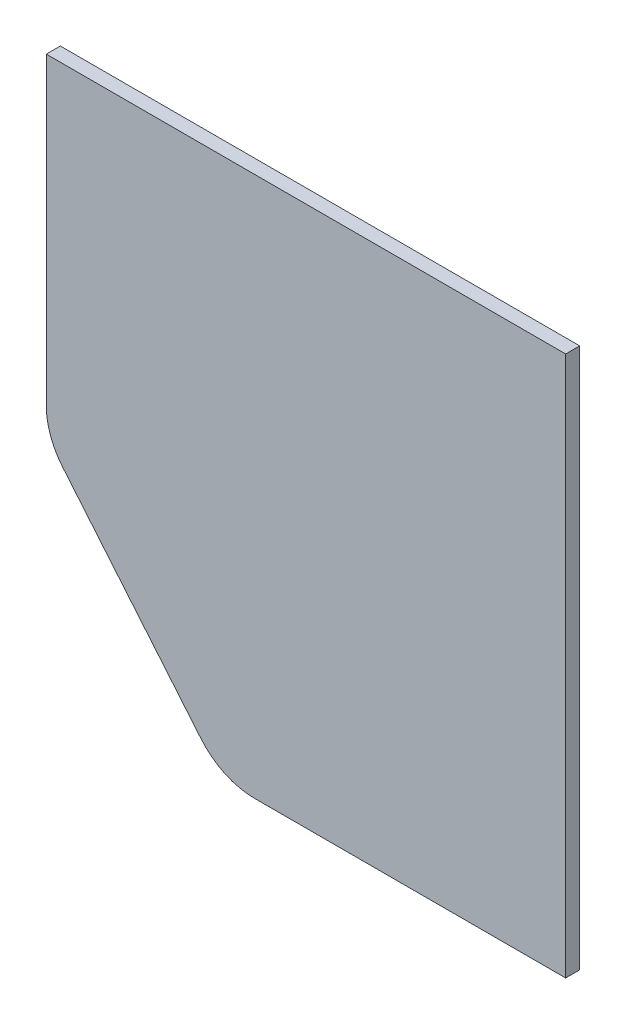
from build123d import *

# Parameters (mm, degrees)
ESBO_O1_W                  = 74
ESBO_O1_H                  = 77
RESSALTO_EXTRUS_O1_DEPTH   = 2
CORTE_EXTRUS_O1_DEPTH      = 97.782446012
CORTE_EXTRUS_O1_DEPTH_BACK = 97.782446012
FILETE1_R                  = 10
FILETE2_R                  = 10


with BuildPart() as part:
    # Esboço1 → Ressalto-extrusão1 (new body)
    with BuildSketch(Plane.XY):
        with Locations((-49.165685596, 5.526315789)):
            Rectangle(ESBO_O1_W, ESBO_O1_H)
    extrude(amount=RESSALTO_EXTRUS_O1_DEPTH)

    # Esboço2 → Corte-extrusão1 (cut, two sides: drawn at the far end of the back side and taken through both)
    with BuildSketch(Plane.XY.offset(2).offset(-CORTE_EXTRUS_O1_DEPTH_BACK)):
        Polygon((62.093925387, -180.88521739), (-61.165685596, -32.973684211), (-86.165685596, -2.973684211), (-209.425296578, 144.937848968), (-505.248362936, -101.581372997), (-233.729140971, -427.404439354), align=None)
    extrude(amount=CORTE_EXTRUS_O1_DEPTH + CORTE_EXTRUS_O1_DEPTH_BACK, mode=Mode.SUBTRACT)

    # Filete1
    filete1_edges = [part.edges().sort_by_distance(p)[0] for p in [
        (-86.165685596, -2.973684211, 1),
    ]]
    fillet(filete1_edges, radius=FILETE1_R)

    # Filete2
    filete2_edges = [part.edges().sort_by_distance(p)[0] for p in [
        (-61.165685596, -32.973684211, 1),
    ]]
    fillet(filete2_edges, radius=FILETE2_R)


solid = part.part
